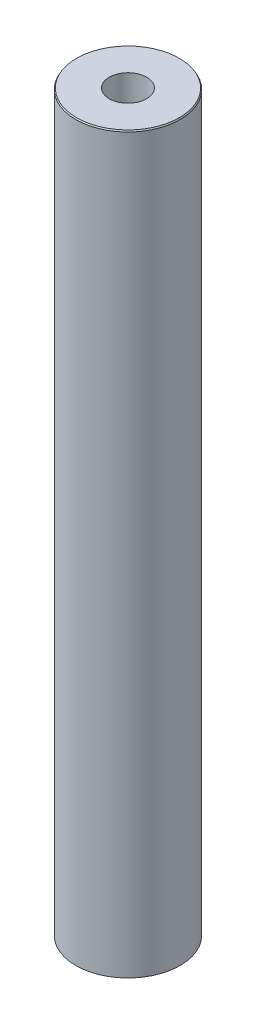
from build123d import *
from OCP.BRepFilletAPI import BRepFilletAPI_MakeChamfer

# Parameters (mm, degrees)
SKETCH1_R           = 42.5
BOSS_EXTRUDE1_DEPTH = 598.629961302
SKETCH2_R           = 15.241506266
CUT_EXTRUDE1_DEPTH  = 602.639701622
CHAMFER1_SIZE       = 1.052030355
CHAMFER1_SIZE2      = 0.607390009


with BuildPart() as part:
    # Sketch1 → Boss-Extrude1 (new body)
    with BuildSketch(Plane(origin=(0, 0, 0), x_dir=(1, 0, 0), z_dir=(0, 1, 0))):
        Circle(SKETCH1_R)
    extrude(amount=BOSS_EXTRUDE1_DEPTH)

    # Sketch2 → Cut-Extrude1 (cut, through all)
    with BuildSketch(Plane(origin=(0, 0, 0), x_dir=(1, 0, 0), z_dir=(0, 1, 0))):
        Circle(SKETCH2_R)
    extrude(amount=CUT_EXTRUDE1_DEPTH, mode=Mode.SUBTRACT)

    # Chamfer1: one chamfer whose edges measure the first distance from different faces: ONE call of the kernel's chamfer builder (chamfer() names one face for all edges)
    chamfer1_edges_1 = [part.edges().sort_by_distance(p)[0] for p in [
        (-42.5, 598.629961302, 0),
    ]]
    chamfer1_side_1 = [part.faces().sort_by_distance(p)[0] for p in [
        (-42.5, 299.314980651, 0),
    ]]
    chamfer1_edges_2 = [part.edges().sort_by_distance(p)[0] for p in [
        (-42.5, 0, 0),
    ]]
    chamfer1_side_2 = [part.faces().sort_by_distance(p)[0] for p in [
        (-41.297918472, 0, 0),
    ]]
    chamfer1 = BRepFilletAPI_MakeChamfer(part.part.solid().wrapped)
    for e in chamfer1_edges_1:
        chamfer1.Add(CHAMFER1_SIZE, CHAMFER1_SIZE2, e.wrapped, chamfer1_side_1[0].wrapped)  # the first distance lies on this face
    for e in chamfer1_edges_2:
        chamfer1.Add(CHAMFER1_SIZE, CHAMFER1_SIZE2, e.wrapped, chamfer1_side_2[0].wrapped)  # the first distance lies on this face
    add(Compound.cast(chamfer1.Shape()), mode=Mode.REPLACE)


solid = part.part
